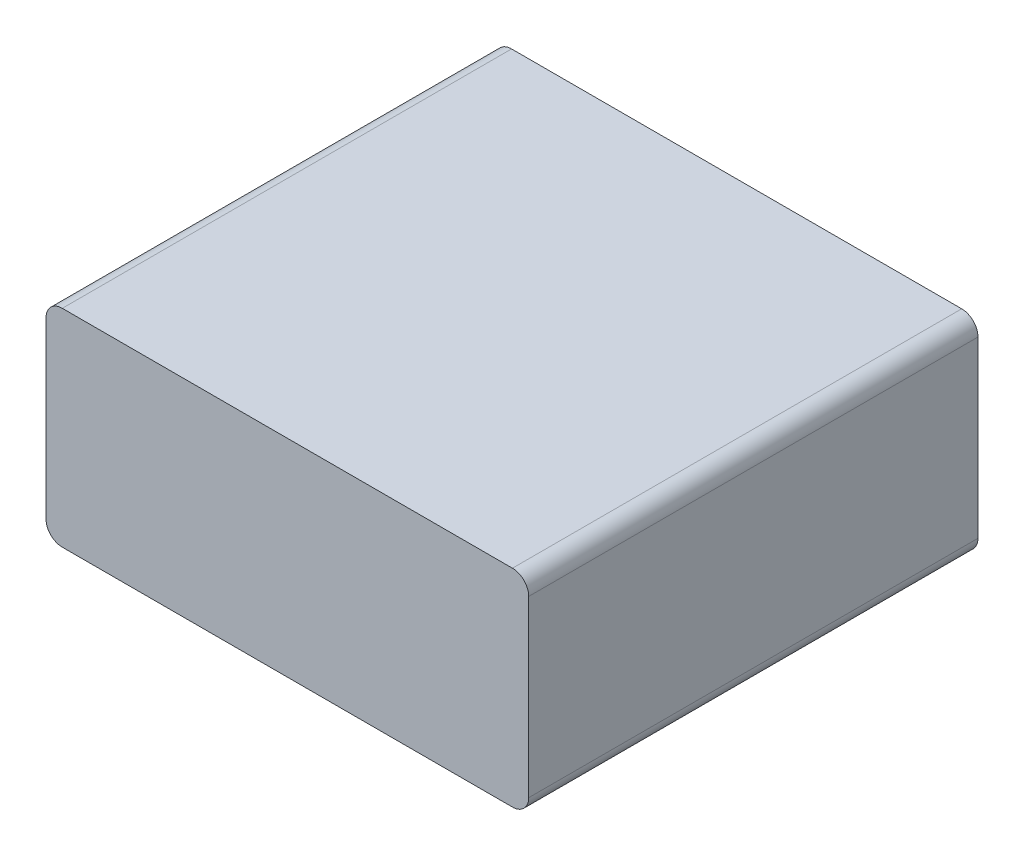
from build123d import *

# Parameters (mm, degrees)
BOSS_EXTRUDE1_DEPTH = 82.74


with BuildPart() as part:
    # Sketch1 → Boss-Extrude1 (new body)
    with BuildSketch(Plane.XY):
        with BuildLine():
            Line((41.45, -19.05), (-41.45, -19.05))
            ThreePointArc((-41.45, -19.05), (-43.571320344, -18.171320344), (-44.45, -16.05))
            Line((-44.45, -16.05), (-44.45, 16.05))
            ThreePointArc((-44.45, 16.05), (-43.571320344, 18.171320344), (-41.45, 19.05))
            Line((-41.45, 19.05), (41.45, 19.05))
            ThreePointArc((41.45, 19.05), (43.571320344, 18.171320344), (44.45, 16.05))
            Line((44.45, 16.05), (44.45, -16.05))
            ThreePointArc((44.45, -16.05), (43.571320344, -18.171320344), (41.45, -19.05))
        make_face()
    extrude(amount=BOSS_EXTRUDE1_DEPTH)


solid = part.part
